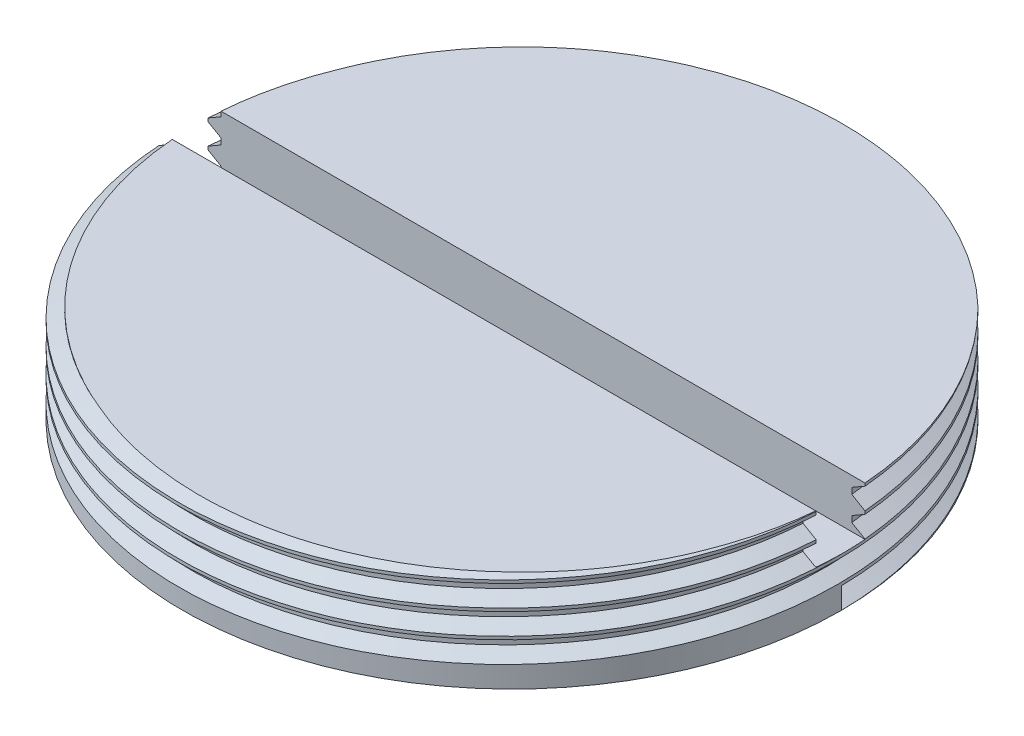
from build123d import *
from build123d.topology import SkipClean

# Parameters (mm, degrees)
SKETCH_1_R          = 13.5
EXTRUDE_1_DEPTH     = 4
SKETCH_2_W          = 32
SKETCH_2_H          = 2
CUT_EXTRUDE_1_DEPTH = 2
THREAD_1_PITCH      = 1


with BuildPart() as part:
    # Sketch 1 → Бобышка-Вытянуть1 (new body)
    with BuildSketch(Plane(origin=(0, 0, 0), x_dir=(1, 0, 0), z_dir=(0, 1, 0))):
        with Locations(Location((0, 0, 0), (0, 0, 270))):
            Circle(SKETCH_1_R)
    extrude(amount=EXTRUDE_1_DEPTH)

    # Эскиз2 → Вырез-Вытянуть1 (cut)
    with BuildSketch(Plane(origin=(0, 4, 0), x_dir=(1, 0, 0), z_dir=(0, 1, 0))):
        Rectangle(SKETCH_2_W, SKETCH_2_H)
    extrude(amount=-CUT_EXTRUDE_1_DEPTH, mode=Mode.SUBTRACT)

    # Резьба1: the profile of Sketch 1 2 profile screwed along a right-hand helix of 4 turns, 8 arcs to a turn; built about Z, then put on its axis
    with SkipClean():  # the faces are left unmerged after this step: merging them gives an invalid solid
        thread_1_z = Axis((0, 0, 0), (0, 0, 1))
        thread_1_corners = [(13.5003, 0, -0.000173205), (13.5003, 0, 0.875173202), (12.958734125, 0, 0.562499999), (12.958734125, 0, 0.312499999)]
        with BuildLine(mode=Mode.PRIVATE) as thread_1_profile:
            Line(thread_1_corners[0], thread_1_corners[1])
            Line(thread_1_corners[1], thread_1_corners[2])
            Line(thread_1_corners[2], thread_1_corners[3])
            Line(thread_1_corners[3], thread_1_corners[0])
        thread_1_cap = Face(thread_1_profile.wire())
        thread_1_turn_angles = [0, 22.5, 45, 67.5, 90, 112.5, 135, 157.5, 180, 202.5, 225, 247.5, 270, 292.5, 315, 337.5, 360]
        thread_1_turn_weights = [1, 0.9238795325112867, 1, 0.9238795325112867, 1, 0.9238795325112867, 1, 0.9238795325112867, 1, 0.9238795325112867, 1, 0.9238795325112867, 1, 0.9238795325112867, 1, 0.9238795325112867, 1]
        thread_1_turn_rails = [Edge.make_bspline([Vector(p[0], p[1], 0).rotate(thread_1_z, thread_1_turn_angles[k]) / thread_1_turn_weights[k] + Vector(0, 0, p[2] + THREAD_1_PITCH * thread_1_turn_angles[k] / 360) for k in range(17)], [0, 0, 0, 1, 1, 2, 2, 3, 3, 4, 4, 5, 5, 6, 6, 7, 7, 8, 8, 8], 2, thread_1_turn_weights) for p in thread_1_corners]
        thread_1_turn_sides = [Face.make_surface_from_curves(thread_1_turn_rails[p[0]], thread_1_turn_rails[p[1]]) for p in [(0, 1), (1, 2), (2, 3), (3, 0)]]
        thread_1 = Plane(origin=(0, 0, 0), x_dir=(1, 0, 0), z_dir=(0, 1, 0)) * Solid(Shell([*[p.moved(Location((0, 0, THREAD_1_PITCH * i))) for i in range(4) for p in thread_1_turn_sides], thread_1_cap, thread_1_cap.rotate(thread_1_z, 1440).moved(Location((0, 0, THREAD_1_PITCH * 1440 / 360)))]))
        add(thread_1, mode=Mode.SUBTRACT)


solid = part.part
